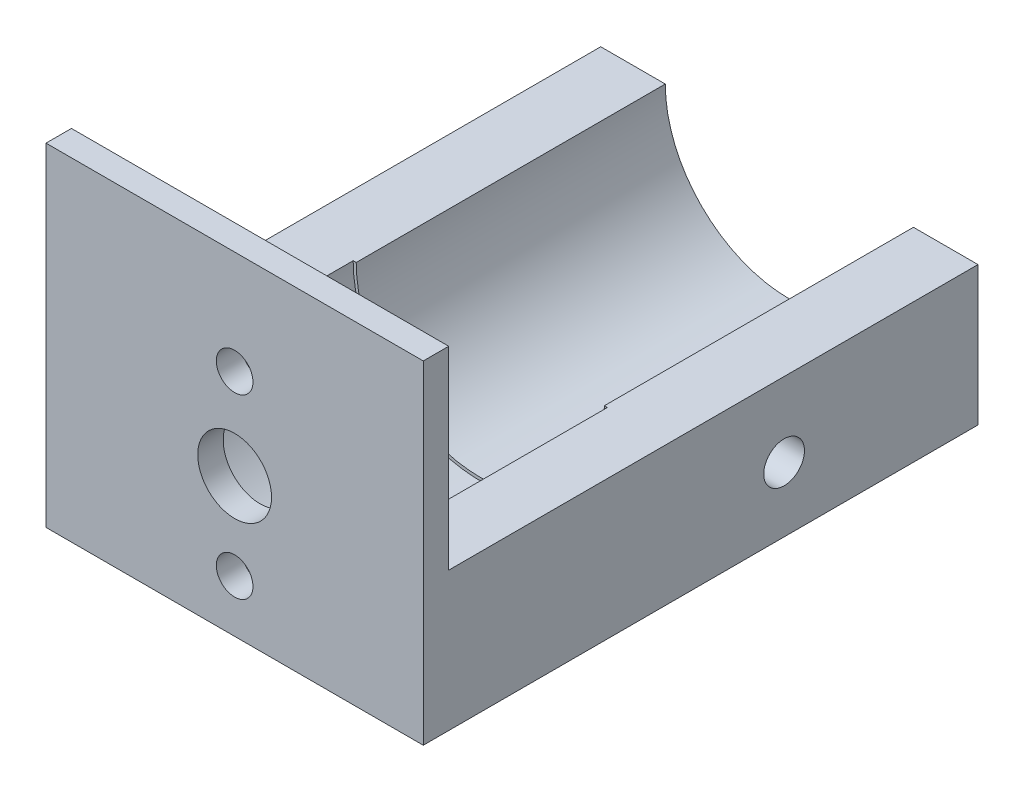
from build123d import *

# Parameters (mm, degrees)
BOSS_EXTRUDE1_DEPTH = 30.364999976
BOSS_EXTRUDE2_DEPTH = 21.63499991
SKETCH4_W           = 37.064796383
SKETCH4_H           = 32.7
SKETCH4_R           = 3.625
SKETCH4_R_2         = 1.8
BOSS_EXTRUDE3_DEPTH = 2.5
SKETCH5_R           = 2
CUT_EXTRUDE1_DEPTH  = 7
SKETCH6_R           = 2.000000064
CUT_EXTRUDE2_DEPTH  = 7
CUT_EXTRUDE3_START  = -7
SKETCH7_R           = 2
CUT_EXTRUDE3_DEPTH  = 7


with BuildPart() as part:
    # Sketch1 → Boss-Extrude1 (new body)
    with BuildSketch(Plane.XY):
        with BuildLine():
            Line((23.763847258, 19.05), (23.763847258, 5.4))
            Line((23.763847258, 5.4), (-13.300949125, 5.4))
            Line((-13.300949125, 5.4), (-13.300949125, 19.05))
            Line((-13.300949125, 19.05), (-6.958949124, 19.05))
            ThreePointArc((-6.958949124, 19.05), (5.231449067, 6.859601809), (17.421847257, 19.05))
            Line((17.421847257, 19.05), (23.763847258, 19.05))
        make_face()
    extrude(amount=BOSS_EXTRUDE1_DEPTH)

    # Sketch3 → Boss-Extrude2 (add)
    with BuildSketch(Plane.XY.offset(30.364999976)):
        with BuildLine():
            Line((-13.300949125, 19.05), (-13.300949125, 5.4))
            Line((-13.300949125, 5.4), (23.763847258, 5.4))
            Line((23.763847258, 5.4), (23.763847258, 19.05))
            Line((23.763847258, 19.05), (17.72184715, 19.05))
            ThreePointArc((17.72184715, 19.05), (5.231449012, 6.559601862), (-7.258949126, 19.05))
            Line((-7.258949126, 19.05), (-13.300949125, 19.05))
        make_face()
    extrude(amount=BOSS_EXTRUDE2_DEPTH)

    # Sketch4 → Boss-Extrude3 (add)
    with BuildSketch(Plane.XY.offset(51.999999886)):
        with Locations((5.231449067, 21.75)):
            Rectangle(SKETCH4_W, SKETCH4_H)
        with Locations((5.231449093, 19.05)):
            Circle(SKETCH4_R, mode=Mode.SUBTRACT)
        with Locations((5.231449093, 10.541)):
            Circle(SKETCH4_R_2, mode=Mode.SUBTRACT)
        with Locations((5.231449093, 27.94)):
            Circle(SKETCH4_R_2, mode=Mode.SUBTRACT)
    extrude(amount=BOSS_EXTRUDE3_DEPTH)

    # Sketch5 → Cut-Extrude1 (cut)
    with BuildSketch(Plane.XZ.offset(-5.4)):
        with Locations((-8.220949125, 48.149999886)):
            Circle(SKETCH5_R)
        with Locations((18.683847258, 48.149999886)):
            Circle(SKETCH5_R)
        with Locations((-8.220949125, 6.35)):
            Circle(SKETCH5_R)
        with Locations((18.683847258, 6.35)):
            Circle(SKETCH5_R)
    extrude(amount=-CUT_EXTRUDE1_DEPTH, mode=Mode.SUBTRACT)

    # Sketch6 → Cut-Extrude2 (cut)
    with BuildSketch(Plane.ZY.offset(13.300949125)):
        with Locations((19.05, 11.75)):
            Circle(SKETCH6_R)
    extrude(amount=-CUT_EXTRUDE2_DEPTH, mode=Mode.SUBTRACT)

    # Sketch7 → Cut-Extrude3 (cut)
    with BuildSketch(Plane(origin=(23.763847258, 0, 0), x_dir=(0, 0, -1), z_dir=(1, 0, 0)).offset(CUT_EXTRUDE3_START)):
        with Locations((-19.05, 11.75)):
            Circle(SKETCH7_R)
    extrude(amount=CUT_EXTRUDE3_DEPTH, mode=Mode.SUBTRACT)


solid = part.part
